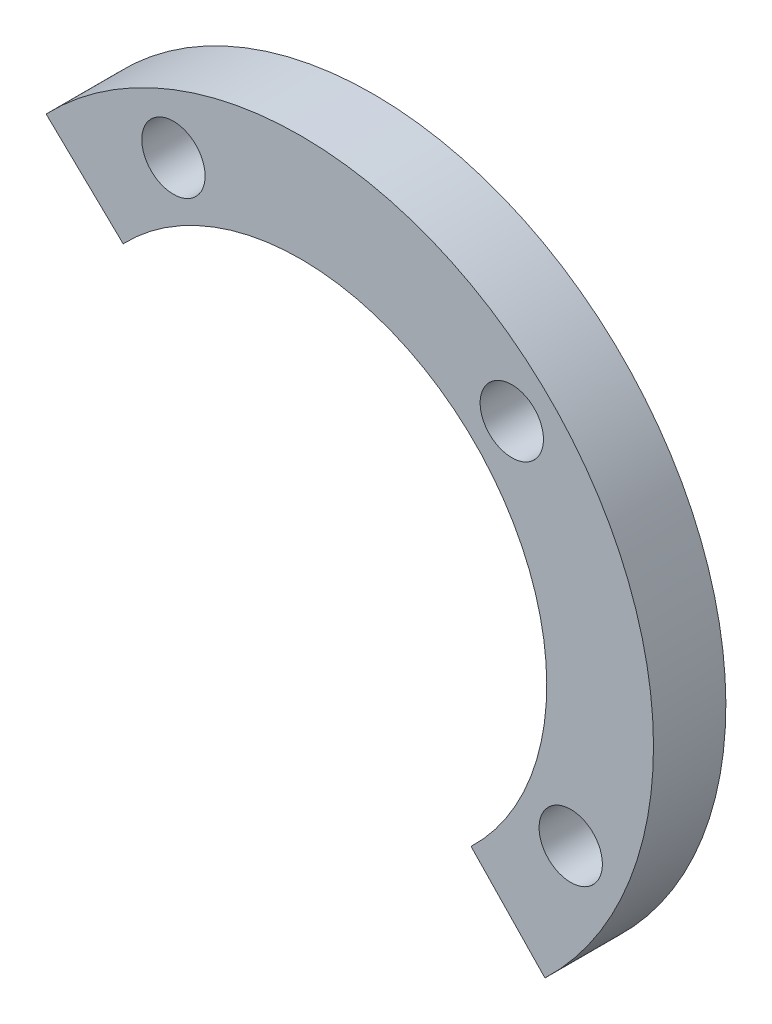
from build123d import *

# Parameters (mm, degrees)
SKETCH1_R           = 1.75
BOSS_EXTRUDE1_DEPTH = 4


with BuildPart() as part:
    # Sketch1 → Boss-Extrude1 (new body)
    with BuildSketch(Plane.XY):
        with BuildLine():
            Line((74.415384615, 55.186207026), (78.5, 50.928752721))
            ThreePointArc((78.5, 50.928752721), (78.788582233, 78.788582233), (50.928752721, 78.5))
            Line((50.928752721, 78.5), (55.186207026, 74.415384615))
            ThreePointArc((55.186207026, 74.415384615), (70.07407211, 77.617994778), (78.6, 65))
            ThreePointArc((78.6, 65), (77.51018047, 59.665641124), (74.415384615, 55.186207026))
        make_face()
        with Locations((79.925281419, 57.965373175)):
            Circle(SKETCH1_R, mode=Mode.SUBTRACT)
        with Locations((57.965373175, 79.925281419)):
            Circle(SKETCH1_R, mode=Mode.SUBTRACT)
        with Locations((76.66726189, 76.66726189)):
            Circle(SKETCH1_R, mode=Mode.SUBTRACT)
    extrude(amount=BOSS_EXTRUDE1_DEPTH)


solid = part.part
